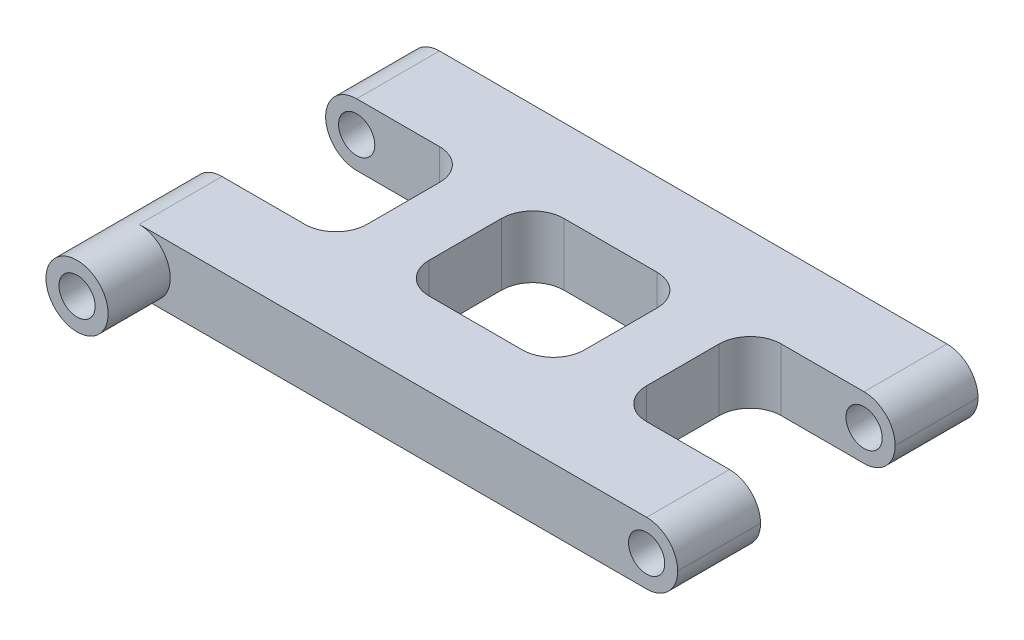
from build123d import *

# Parameters (mm, degrees)
CROQUIS1_W                 = 15
CROQUIS1_H                 = 13
SALIENTE_EXTRUIR1_DEPTH    = 3
REDONDEO1_R                = 3
CROQUIS6_R                 = 3
SALIENTE_EXTRUIR2_DEPTH    = 6
CORTAR_EXTRUIR1_DEPTH      = 66.261014396
CORTAR_EXTRUIR1_DEPTH_BACK = 66.261014396
CROQUIS2_R                 = 1.75
CORTAR_EXTRUIR2_DEPTH      = 63.24949799
CORTAR_EXTRUIR2_DEPTH_BACK = 63.24949799
CROQUIS3_R                 = 1.75
REDONDEO2_R                = 3


with BuildPart() as part:
    # Croquis1 → Saliente-Extruir1 (new, symmetric)
    with BuildSketch(Plane(origin=(0, 0, 0), x_dir=(1, 0, 0), z_dir=(0, 1, 0))):
        Polygon((0, 0), (0, 8), (14, 8), (14, 21), (0, 21), (0, 29), (55, 29), (55, 21), (41, 21), (41, 8), (55, 8), (55, 0), align=None)
        with Locations((27.5, 14.5)):
            Rectangle(CROQUIS1_W, CROQUIS1_H, mode=Mode.SUBTRACT)
    extrude(amount=SALIENTE_EXTRUIR1_DEPTH, both=True)

    # Redondeo1
    redondeo1_edges = [part.edges().sort_by_distance(p)[0] for p in [
        (0, -3, -4),
        (0, 3, -4),
        (0, -3, -25),
        (0, 3, -25),
        (55, -3, -4),
        (55, 3, -4),
        (55, 3, -25),
        (55, -3, -25),
    ]]
    fillet(redondeo1_edges, radius=REDONDEO1_R - 0.0001)  # a hair under: the kernel refuses the full size

    # Croquis6 → Saliente-Extruir2 (add)
    with BuildSketch(Plane.XY):
        with Locations(Location((3, 0, 0), (0, 0, 180))):
            Circle(CROQUIS6_R)
    extrude(amount=SALIENTE_EXTRUIR2_DEPTH)

    # Croquis2 → Cortar-Extruir1 (cut, two sides: drawn at the far end of the back side and taken through both)
    with BuildSketch(Plane.XY.offset(6).offset(-CORTAR_EXTRUIR1_DEPTH_BACK)):
        with Locations((3, 0)):
            Circle(CROQUIS2_R)
    extrude(amount=CORTAR_EXTRUIR1_DEPTH + CORTAR_EXTRUIR1_DEPTH_BACK, mode=Mode.SUBTRACT)

    # Croquis3 → Cortar-Extruir2 (cut, two sides: drawn at the far end of the back side and taken through both)
    with BuildSketch(Plane.XY.offset(-CORTAR_EXTRUIR2_DEPTH_BACK)):
        with Locations((52, 0)):
            Circle(CROQUIS3_R)
    extrude(amount=CORTAR_EXTRUIR2_DEPTH + CORTAR_EXTRUIR2_DEPTH_BACK, mode=Mode.SUBTRACT)

    # Redondeo2
    redondeo2_edges = [part.edges().sort_by_distance(p)[0] for p in [
        (14, 0, -8),
        (14, 0, -21),
        (41, 0, -21),
        (41, 0, -8),
        (20, 0, -21),
        (20, 0, -8),
        (35, 0, -8),
        (35, 0, -21),
    ]]
    fillet(redondeo2_edges, radius=REDONDEO2_R)


solid = part.part
